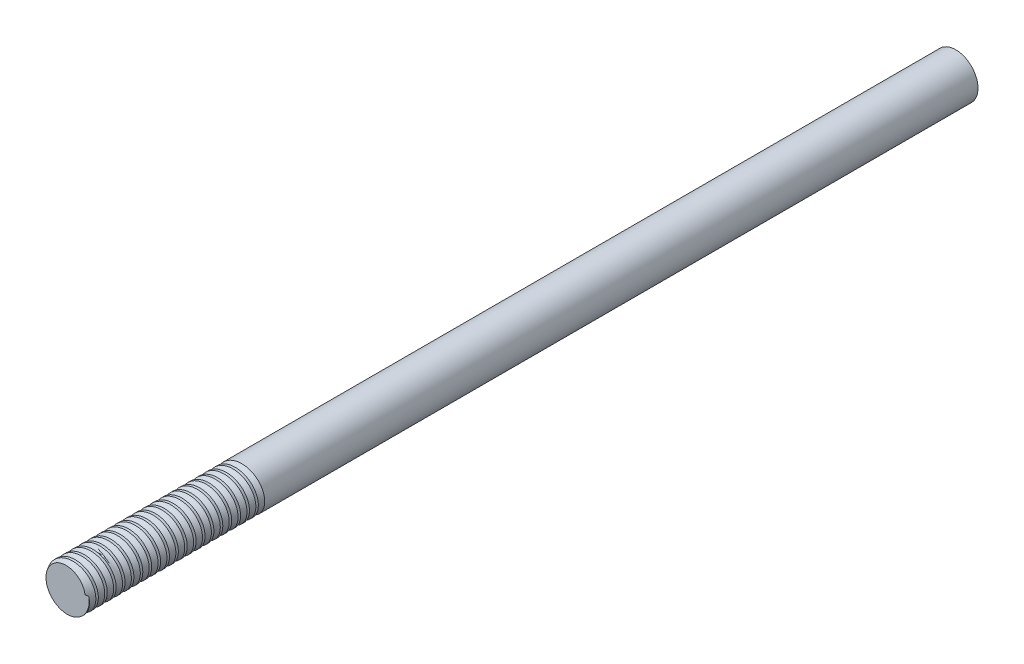
from build123d import *

# Parameters (mm, degrees)
SKETCH2_R           = 3.175
BOSS_EXTRUDE1_DEPTH = 127
CUT_SWEEP8_PITCH    = 1.27


with BuildPart() as part:
    # Sketch2 → Boss-Extrude1 (new body)
    with BuildSketch(Plane.XY):
        Circle(SKETCH2_R)
    extrude(amount=BOSS_EXTRUDE1_DEPTH)

    # Cut-Sweep8: the profile of Sketch4 screwed along a right-hand helix of 20 turns, 8 arcs to a turn; built about Z, then put on its axis
    cut_sweep8_z = Axis((0, 0, 0), (0, 0, 1))
    cut_sweep8_corners = [(2.647070914, 0, -0.9144), (3.702929086, 0, -0.9144), (3.175, 0, 0)]
    with BuildLine(mode=Mode.PRIVATE) as cut_sweep8_profile:
        Line(cut_sweep8_corners[0], cut_sweep8_corners[1])
        Line(cut_sweep8_corners[1], cut_sweep8_corners[2])
        Line(cut_sweep8_corners[2], cut_sweep8_corners[0])
    cut_sweep8_cap = Face(cut_sweep8_profile.wire())
    cut_sweep8_turn_angles = [0, 22.5, 45, 67.5, 90, 112.5, 135, 157.5, 180, 202.5, 225, 247.5, 270, 292.5, 315, 337.5, 360]
    cut_sweep8_turn_weights = [1, 0.9238795325112867, 1, 0.9238795325112867, 1, 0.9238795325112867, 1, 0.9238795325112867, 1, 0.9238795325112867, 1, 0.9238795325112867, 1, 0.9238795325112867, 1, 0.9238795325112867, 1]
    cut_sweep8_turn_rails = [Edge.make_bspline([Vector(p[0], p[1], 0).rotate(cut_sweep8_z, cut_sweep8_turn_angles[k]) / cut_sweep8_turn_weights[k] + Vector(0, 0, p[2] + CUT_SWEEP8_PITCH * cut_sweep8_turn_angles[k] / 360) for k in range(17)], [0, 0, 0, 1, 1, 2, 2, 3, 3, 4, 4, 5, 5, 6, 6, 7, 7, 8, 8, 8], 2, cut_sweep8_turn_weights) for p in cut_sweep8_corners]
    cut_sweep8_turn_sides = [Face.make_surface_from_curves(cut_sweep8_turn_rails[p[0]], cut_sweep8_turn_rails[p[1]]) for p in [(0, 1), (1, 2), (2, 0)]]
    cut_sweep8 = Plane(origin=(0, 0, 127), x_dir=(0, -1, 0), z_dir=(0, 0, -1)) * Solid(Shell([*[p.moved(Location((0, 0, CUT_SWEEP8_PITCH * i))) for i in range(20) for p in cut_sweep8_turn_sides], cut_sweep8_cap, cut_sweep8_cap.rotate(cut_sweep8_z, 7200).moved(Location((0, 0, CUT_SWEEP8_PITCH * 7200 / 360)))]))
    add(cut_sweep8, mode=Mode.SUBTRACT)


solid = part.part
